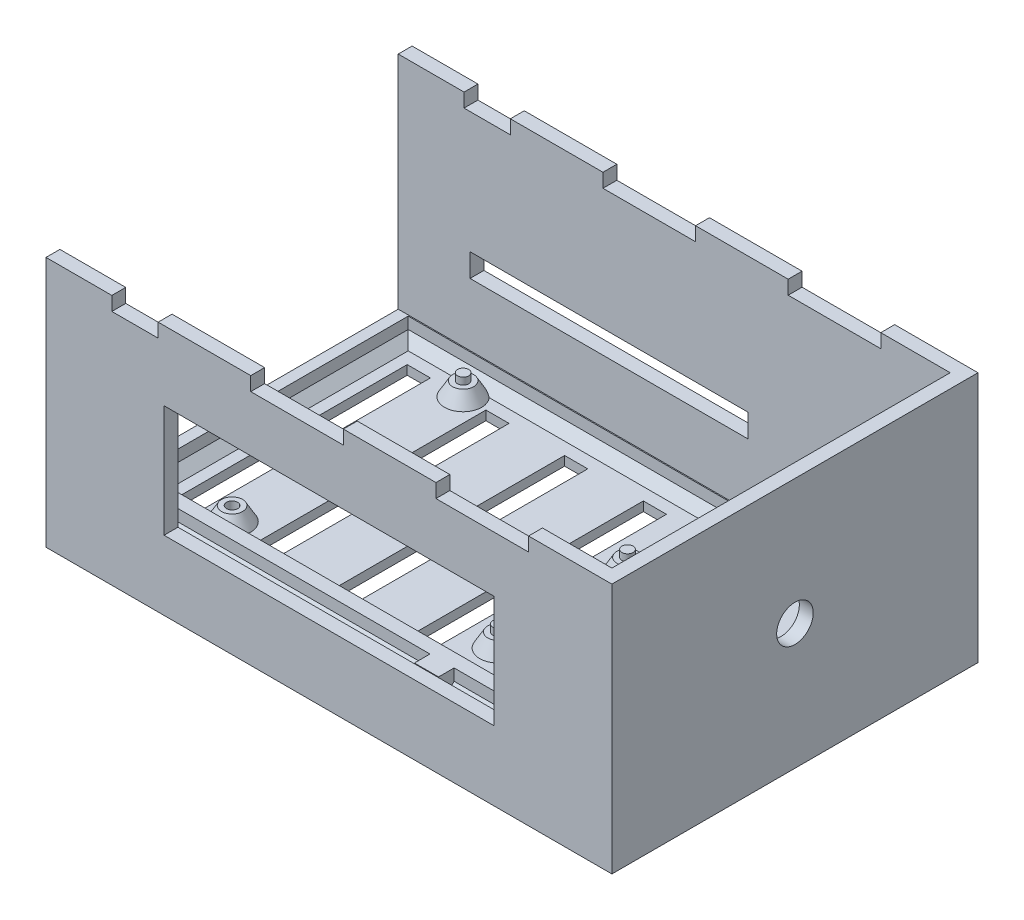
from build123d import *

# Parameters (mm, degrees)
SKETCH_1_W              = 95
SKETCH_1_H              = 100
EXTRUDE_1_DEPTH         = 2
SKETCH_3_R              = 1.2
EXTRUDE_2_DEPTH         = 7
SKETCH_4_R              = 2
EXTRUDE_3_DEPTH         = 3
CHAMFER_1_SIZE          = 2
CHAMFER_1_SIZE_2        = 3.464101615
SKETCH_5_W              = 88.6
SKETCH_5_H              = 22
SKETCH_5_H_2            = 10
EXTRUDE_4_DEPTH         = 50
SKETCH_8_W              = 2.378668295
SKETCH_8_H              = 57.848959614
SKETCH_8_W_2            = 2.852804632
EXTRUDE_6_DEPTH         = 4.5
SKETCH_7_W              = 5
SKETCH_7_H              = 50
SKETCH_7_H_2            = 9
SKETCH_7_H_3            = 5
CUT_EXTRUDE_1_DEPTH     = 4
CHAMFER_START           = -83.16108201
CHAMFER_2_DEPTH         = 12
CHAMFER_START_2         = -66.16108201
CHAMFER_2_2_DEPTH       = 12
CHAMFER_START_3         = -49.16108201
CHAMFER_2_3_DEPTH       = 12
CHAMFER_START_4         = -32.16108201
CHAMFER_2_4_DEPTH       = 12
CHAMFER_START_5         = -15.16108201
CHAMFER_2_5_DEPTH       = 12.308277378
CHAMFER_START_6         = -92.621331705
CHAMFER_2_6_DEPTH       = 4.460249695
CHAMFER_2_7_DEPTH       = 89.768527073
CHAMFER_START_7         = 1
CHAMFER_2_8_DEPTH       = 86.998233291
CHAMFER_2_9_DEPTH       = 26.149273677
CHAMFER_START_8         = 84.998233291
CHAMFER_2_10_DEPTH      = 14.001766709
SKETCH_13_W             = 5.505876785
SKETCH_13_H             = 3
CUT_EXTRUDE_6_DEPTH     = 10
SKETCH_17_W             = 2
SKETCH_17_H             = 2
SKETCH_17_W_2           = 0.768088879
EXTRUDE_9_DEPTH         = 20
CHAMFER_3_SIZE          = 2
CHAMFER_3_SIZE_2        = 3.464101615
CHAMFER_6_SIZE          = 4
SKETCH_18_W             = 4.206221656
SKETCH_18_H             = 3.021554381
SKETCH_18_W_2           = 5.210107228
SKETCH_18_H_2           = 3.356992826
EXTRUDE_11_DEPTH        = 50
FILLET_2_R              = 2
SKETCH_20_W             = 2.378668295
SKETCH_20_H             = 7.010495323
EXTRUDE_13_DEPTH        = 30
SKETCH_21_W             = 2.378668295
SKETCH_21_H             = 4.566526532
EXTRUDE_14_DEPTH        = 12
SKETCH_22_R             = 1.2
CUT_EXTRUDE_7_DEPTH     = 3
SKETCH_24_W             = 14.181336584
SKETCH_24_H             = 31.500920509
CUT_EXTRUDE_8_DEPTH     = 1
CHAMFER_7_SIZE          = 2
CORTAR_EXTRUIR1_DEPTH   = 147.714007511
CROQUIS4_W              = 122.22
CROQUIS4_H              = 54.22
CROQUIS4_W_2            = 71.22
CROQUIS4_H_2            = 24.22
SALIENTE_EXTRUIR2_DEPTH = 3
CROQUIS5_W              = 100
CROQUIS5_H              = 6.5
SALIENTE_EXTRUIR3_DEPTH = 27.22
CROQUIS10_W             = 122.22
CROQUIS10_H             = 23.928408898
CORTAR_EXTRUIR2_DEPTH   = 149.024316921
SALIENTE_EXTRUIR4_REACH = 170.148
CROQUIS13_W             = 1.988266343
CROQUIS13_H             = 6.5
CROQUIS14_W             = 122.22
CROQUIS14_H             = 54.22
SALIENTE_EXTRUIR5_DEPTH = 3
CROQUIS15_W             = 79.071591102
CROQUIS15_H             = 54.22
SALIENTE_EXTRUIR6_DEPTH = 3
CROQUIS16_R             = 3.95
CORTAR_EXTRUIR3_DEPTH   = 169.147723148
CROQUIS18_W             = 10
CROQUIS18_H             = 3
CROQUIS18_W_2           = 20
CORTAR_EXTRUIR4_DEPTH   = 3
CROQUIS23_W             = 60
CROQUIS23_H             = 5
CORTAR_EXTRUIR5_DEPTH   = 3


with BuildPart() as part:
    # Эскиз1 → Бобышка-Вытянуть1 (new body)
    with BuildSketch(Plane(origin=(0, 0, 0), x_dir=(1, 0, 0), z_dir=(0, 1, 0))):
        with Locations((-47.5, -50)):
            Rectangle(SKETCH_1_W, SKETCH_1_H)
    extrude(amount=-EXTRUDE_1_DEPTH)

    # Эскиз3 → Бобышка-Вытянуть2 (add)
    with BuildSketch(Plane(origin=(0, 0, 0), x_dir=(1, 0, 0), z_dir=(0, 1, 0))):
        with Locations(Location((-76.12379646, -31.787862309, 0), (0, 0, 90))):
            Circle(SKETCH_3_R)
        with Locations(Location((-25.32379646, -47.087862309, 0), (0, 0, 90))):
            Circle(SKETCH_3_R)
        with Locations(Location((-25.32379646, -74.987862309, 0), (0, 0, 90))):
            Circle(SKETCH_3_R)
    extrude(amount=EXTRUDE_2_DEPTH)

    # Эскиз4 → Бобышка-Вытянуть3 (add)
    with BuildSketch(Plane(origin=(0, 0, 0), x_dir=(1, 0, 0), z_dir=(0, 1, 0))):
        with Locations(Location((-76.12379646, -31.787862309, 0), (0, 0, 90))):
            Circle(SKETCH_4_R)
        with Locations(Location((-25.32379646, -47.087862309, 0), (0, 0, 90))):
            Circle(SKETCH_4_R)
        with Locations(Location((-25.32379646, -74.987862309, 0), (0, 0, 90))):
            Circle(SKETCH_4_R)
        with Locations(Location((-77.72379646, -80.087862309, 0), (0, 0, 90))):
            Circle(SKETCH_4_R)
    extrude(amount=EXTRUDE_3_DEPTH)

    # Фаска1
    # the kernel refuses this chamfer: 3.464101615, 2 mm, written as the material it adds along each edge
    with BuildSketch(Plane(origin=(-25.32379646, 0, 47.087862309), x_dir=(0, 0, -1), z_dir=(1, 0, 0))) as chamfer_1_piece_1_section:
        Polygon((2 + CHAMFER_1_SIZE, 0), (2, CHAMFER_1_SIZE_2), (2, 0), align=None)
    chamfer_1_piece_1 = revolve(axis=Axis((-25.32379646, 0, 47.087862309), (0, 1, 0)), mode=Mode.PRIVATE)
    chamfer_1_piece_1 = split(chamfer_1_piece_1, bisect_by=Plane(origin=(-25.32379646, 3, 47.087862309), z_dir=(0, -1, 0)), keep=Keep.TOP, mode=Mode.PRIVATE)
    add(chamfer_1_piece_1)
    with BuildSketch(Plane(origin=(-76.12379646, 0, 31.787862309), x_dir=(0, 0, -1), z_dir=(1, 0, 0))) as chamfer_1_piece_2_section:
        Polygon((2 + CHAMFER_1_SIZE, 0), (2, CHAMFER_1_SIZE_2), (2, 0), align=None)
    chamfer_1_piece_2 = revolve(axis=Axis((-76.12379646, 0, 31.787862309), (0, 1, 0)), mode=Mode.PRIVATE)
    chamfer_1_piece_2 = split(chamfer_1_piece_2, bisect_by=Plane(origin=(-76.12379646, 3, 31.787862309), z_dir=(0, -1, 0)), keep=Keep.TOP, mode=Mode.PRIVATE)
    add(chamfer_1_piece_2)
    with BuildSketch(Plane(origin=(-77.72379646, 0, 80.087862309), x_dir=(0, 0, -1), z_dir=(1, 0, 0))) as chamfer_1_piece_3_section:
        Polygon((2 + CHAMFER_1_SIZE, 0), (2, CHAMFER_1_SIZE_2), (2, 0), align=None)
    chamfer_1_piece_3 = revolve(axis=Axis((-77.72379646, 0, 80.087862309), (0, 1, 0)), mode=Mode.PRIVATE)
    chamfer_1_piece_3 = split(chamfer_1_piece_3, bisect_by=Plane(origin=(-77.72379646, 3, 80.087862309), z_dir=(0, -1, 0)), keep=Keep.TOP, mode=Mode.PRIVATE)
    add(chamfer_1_piece_3)
    with BuildSketch(Plane(origin=(-25.32379646, 0, 74.987862309), x_dir=(0, 0, -1), z_dir=(1, 0, 0))) as chamfer_1_piece_4_section:
        Polygon((2 + CHAMFER_1_SIZE, 0), (2, CHAMFER_1_SIZE_2), (2, 0), align=None)
    chamfer_1_piece_4 = revolve(axis=Axis((-25.32379646, 0, 74.987862309), (0, 1, 0)), mode=Mode.PRIVATE)
    chamfer_1_piece_4 = split(chamfer_1_piece_4, bisect_by=Plane(origin=(-25.32379646, 3, 74.987862309), z_dir=(0, -1, 0)), keep=Keep.TOP, mode=Mode.PRIVATE)
    add(chamfer_1_piece_4)

    # Эскиз5 → Бобышка-Вытянуть4 (add)
    # profile 1 of 2: a face of its own
    with BuildSketch(Plane(origin=(0, 0, 0), x_dir=(1, 0, 0), z_dir=(0, 1, 0))):
        Polygon((0, 0), (-95, 0), (-95, -3), (-95, -24.149273677), (-95, -27.149273677), (0, -27.149273677), (0, -24.149273677), (0, -3), align=None)
        with Locations((-47.5, -13.149273677)):
            Rectangle(SKETCH_5_W, SKETCH_5_H, mode=Mode.SUBTRACT)
    # profile 2 of 2: a face of its own
    with BuildSketch(Plane(origin=(0, 0, 0), x_dir=(1, 0, 0), z_dir=(0, 1, 0))):
        Polygon((0, -100), (-95, -100), (-95, -97), (-95, -87.998233291), (-95, -84.998233291), (0, -84.998233291), (0, -87.998233291), (0, -97), align=None)
        with Locations((-47.5, -92.998233291)):
            Rectangle(SKETCH_5_W, SKETCH_5_H_2, mode=Mode.SUBTRACT)
    extrude(amount=EXTRUDE_4_DEPTH)

    # Эскиз8 → Бобышка-Вытянуть6 (add)
    with BuildSketch(Plane(origin=(0, 0, 0), x_dir=(1, 0, 0), z_dir=(0, 1, 0))):
        with Locations((-93.810665852, -56.073753484)):
            Rectangle(SKETCH_8_W, SKETCH_8_H)
        with Locations((-1.426402316, -56.073753484)):
            Rectangle(SKETCH_8_W_2, SKETCH_8_H)
    extrude(amount=EXTRUDE_6_DEPTH)

    # Эскиз7 → Вырез-Вытянуть1 (cut)
    with BuildSketch(Plane(origin=(0, 0, 0), x_dir=(1, 0, 0), z_dir=(0, 1, 0))):
        with Locations((-68.66108201, -56.826653613)):
            Rectangle(SKETCH_7_W, SKETCH_7_H)
        with Locations((-85.66108201, -56.826653613)):
            Rectangle(SKETCH_7_W, SKETCH_7_H)
        with Locations((-68.66108201, -10.718973477)):
            Rectangle(SKETCH_7_W, SKETCH_7_H_2)
        with Locations((-85.66108201, -10.718973477)):
            Rectangle(SKETCH_7_W, SKETCH_7_H_2)
        with Locations((-85.66108201, -92.084172994)):
            Rectangle(SKETCH_7_W, SKETCH_7_H_3)
        with Locations((-51.66108201, -56.826653613)):
            Rectangle(SKETCH_7_W, SKETCH_7_H)
        with Locations((-34.66108201, -56.826653613)):
            Rectangle(SKETCH_7_W, SKETCH_7_H)
        with Locations((-17.66108201, -56.826653613)):
            Rectangle(SKETCH_7_W, SKETCH_7_H)
        with Locations((-68.66108201, -92.084172994)):
            Rectangle(SKETCH_7_W, SKETCH_7_H_3)
        with Locations((-51.66108201, -10.718973477)):
            Rectangle(SKETCH_7_W, SKETCH_7_H_2)
        with Locations((-51.66108201, -92.084172994)):
            Rectangle(SKETCH_7_W, SKETCH_7_H_3)
        with Locations((-34.66108201, -10.718973477)):
            Rectangle(SKETCH_7_W, SKETCH_7_H_2)
        with Locations((-34.66108201, -92.084172994)):
            Rectangle(SKETCH_7_W, SKETCH_7_H_3)
        with Locations((-17.66108201, -10.718973477)):
            Rectangle(SKETCH_7_W, SKETCH_7_H_2)
        with Locations((-17.66108201, -92.084172994)):
            Rectangle(SKETCH_7_W, SKETCH_7_H_3)
    extrude(amount=-CUT_EXTRUDE_1_DEPTH, mode=Mode.SUBTRACT)

    # Фаска2: read off the stored shape, not the designer's step
    # Фаска2 outline → Фаска2 (add)
    with BuildSketch(Plane.YZ.offset(CHAMFER_START)):
        Polygon((0, 89.998233291), (0, 89.584172994), (0.414060297, 89.584172994), align=None)
    extrude(amount=CHAMFER_2_DEPTH)

    # Chamfer 2 2 outline → Chamfer 2 2 (add)
    with BuildSketch(Plane.YZ.offset(CHAMFER_START_2)):
        Polygon((0, 89.998233291), (0, 89.584172994), (0.414060297, 89.584172994), align=None)
    extrude(amount=CHAMFER_2_2_DEPTH)

    # Chamfer 2 3 outline → Chamfer 2 3 (add)
    with BuildSketch(Plane.YZ.offset(CHAMFER_START_3)):
        Polygon((0, 89.998233291), (0, 89.584172994), (0.414060297, 89.584172994), align=None)
    extrude(amount=CHAMFER_2_3_DEPTH)

    # Chamfer 2 4 outline → Chamfer 2 4 (add)
    with BuildSketch(Plane.YZ.offset(CHAMFER_START_4)):
        Polygon((0, 89.998233291), (0, 89.584172994), (0.414060297, 89.584172994), align=None)
    extrude(amount=CHAMFER_2_4_DEPTH)

    # Chamfer 2 5 outline → Chamfer 2 5 (add)
    with BuildSketch(Plane.YZ.offset(CHAMFER_START_5)):
        Polygon((0, 89.998233291), (0, 89.584172994), (0.414060297, 89.584172994), align=None)
    extrude(amount=CHAMFER_2_5_DEPTH)

    # Chamfer 2 6 outline → Chamfer 2 6 (add)
    with BuildSketch(Plane.YZ.offset(CHAMFER_START_6)):
        Polygon((0, 89.998233291), (0, 89.584172994), (0.414060297, 89.584172994), align=None)
    extrude(amount=CHAMFER_2_6_DEPTH)

    # Chamfer 2 7 outline → Chamfer 2 7 (add)
    with BuildSketch(Plane.YZ.offset(CHAMFER_START_6)):
        Polygon((0, 97.998233291), (0, 95.998233291), (2, 97.998233291), align=None)
        Polygon((0.414060297, 89.584172994), (0, 89.584172994), (0, 87.998233291), (2, 87.998233291), align=None)
        Polygon((0, 24.149273677), (0, 22.149273677), (2, 24.149273677), align=None)
        Polygon((2, 2.149273677), (0, 4.149273677), (0, 2.149273677), align=None)
        Polygon((0, 27.149273677), (2, 27.149273677), (0, 29.149273677), align=None)
        Polygon((0, 84.998233291), (0, 82.998233291), (2, 84.998233291), align=None)
    extrude(amount=CHAMFER_2_7_DEPTH)

    # Chamfer 2 8 outline → Chamfer 2 8 (add)
    with BuildSketch(Plane.XY.offset(CHAMFER_START_7)):
        Polygon((-92.621331705, 0), (-90.621331705, 0), (-92.621331705, 2), align=None)
        Polygon((-4.852804632, 0), (-2.852804632, 0), (-2.852804632, 2), align=None)
    extrude(amount=CHAMFER_2_8_DEPTH)

    # Chamfer 2 9 outline → Chamfer 2 9 (add)
    with BuildSketch(Plane.XY.offset(CHAMFER_START_7)):
        Polygon((-3.2, 2), (-5.2, 0), (-4.852804632, 0), (-3.2, 1.652804632), align=None)
        Polygon((-89.8, 0), (-91.8, 2), (-91.8, 1.178668295), (-90.621331705, 0), align=None)
    extrude(amount=CHAMFER_2_9_DEPTH)

    # Chamfer 2 10 outline → Chamfer 2 10 (add)
    with BuildSketch(Plane.XY.offset(CHAMFER_START_8)):
        Polygon((-89.8, 0), (-91.8, 2), (-91.8, 0), align=None)
    extrude(amount=CHAMFER_2_10_DEPTH)

    # Эскиз13 → Вырез-Вытянуть6 (cut)
    with BuildSketch(Plane(origin=(0, 50, 0), x_dir=(1, 0, 0), z_dir=(0, 1, 0))):
        with Locations((-13.994725416, -25.649273677)):
            Rectangle(SKETCH_13_W, SKETCH_13_H)
        with Locations((-13.994725416, -86.498233291)):
            Rectangle(SKETCH_13_W, SKETCH_13_H)
    extrude(amount=-CUT_EXTRUDE_6_DEPTH, mode=Mode.SUBTRACT)

    # Эскиз17 → Бобышка-Вытянуть9 (add)
    with BuildSketch(Plane(origin=(0, 50, 0), x_dir=(1, 0, 0), z_dir=(0, 1, 0))):
        with Locations((-91.621331705, -28.149273677)):
            Rectangle(SKETCH_17_W, SKETCH_17_H)
        with Locations((-91.621331705, -83.998233291)):
            Rectangle(SKETCH_17_W, SKETCH_17_H)
        with Locations((-5.236849072, -83.998233291)):
            Rectangle(SKETCH_17_W_2, SKETCH_17_H)
        with Locations((-3.852804632, -28.149273677)):
            Rectangle(SKETCH_17_W, SKETCH_17_H)
    extrude(amount=-EXTRUDE_9_DEPTH)

    # Фаска3
    # the kernel refuses this chamfer: 3.464101615, 2 mm, written as the material it adds along each edge
    with BuildSketch(Plane(origin=(-5.620893511, 30, 84.998233291), x_dir=(0, -1, 0), z_dir=(1, 0, 0))) as chamfer_3_piece_1_section:
        Polygon((CHAMFER_3_SIZE, 0), (0, CHAMFER_3_SIZE_2), (0, 0), align=None)
    chamfer_3_piece_1 = extrude(amount=0.768088879, mode=Mode.PRIVATE)
    chamfer_3_piece_1 = split(chamfer_3_piece_1, bisect_by=Plane(origin=(-5.620893511, 30, 82.998233291), z_dir=(0, 0, 1)), keep=Keep.TOP, mode=Mode.PRIVATE)
    add(chamfer_3_piece_1)
    with BuildSketch(Plane(origin=(-92.621331705, 30, 84.998233291), x_dir=(0, -1, 0), z_dir=(1, 0, 0))) as chamfer_3_piece_2_section:
        Polygon((CHAMFER_3_SIZE_2, 0), (0, CHAMFER_3_SIZE), (0, 0), align=None)
    chamfer_3_piece_2 = extrude(amount=2, mode=Mode.PRIVATE)
    chamfer_3_piece_2 = split(chamfer_3_piece_2, bisect_by=Plane(origin=(-92.621331705, 30, 82.998233291), z_dir=(0, 0, 1)), keep=Keep.TOP, mode=Mode.PRIVATE)
    add(chamfer_3_piece_2)
    with BuildSketch(Plane(origin=(-92.621331705, 30, 27.149273677), x_dir=(0, -1, 0), z_dir=(1, 0, 0))) as chamfer_3_piece_3_section:
        Polygon((CHAMFER_3_SIZE_2, 0), (0, -CHAMFER_3_SIZE), (0, 0), align=None)
    chamfer_3_piece_3 = extrude(amount=2, mode=Mode.PRIVATE)
    chamfer_3_piece_3 = split(chamfer_3_piece_3, bisect_by=Plane(origin=(-92.621331705, 30, 29.149273677), z_dir=(0, 0, -1)), keep=Keep.TOP, mode=Mode.PRIVATE)
    add(chamfer_3_piece_3)
    with BuildSketch(Plane(origin=(-2.852804632, 30, 27.149273677), x_dir=(0, -1, 0), z_dir=(-1, 0, 0))) as chamfer_3_piece_4_section:
        Polygon((CHAMFER_3_SIZE_2, 0), (0, CHAMFER_3_SIZE), (0, 0), align=None)
    chamfer_3_piece_4 = extrude(amount=2, mode=Mode.PRIVATE)
    chamfer_3_piece_4 = split(chamfer_3_piece_4, bisect_by=Plane(origin=(-2.852804632, 30, 29.149273677), z_dir=(0, 0, -1)), keep=Keep.TOP, mode=Mode.PRIVATE)
    add(chamfer_3_piece_4)

    # Фаска6
    chamfer_6_edges = [part.edges().sort_by_distance(p)[0] for p in [
        (-91.8, 26, 24.149273677),
        (-91.8, 26, 2.149273677),
        (-91.8, 26, 87.998233291),
        (-3.2, 26, 24.149273677),
        (-3.2, 26, 97.998233291),
        (-3.2, 26, 2.149273677),
    ]]
    chamfer(chamfer_6_edges, length=CHAMFER_6_SIZE - 0.0001)  # a hair under: the kernel refuses the full size

    # Эскиз18 → Бобышка-Вытянуть11 (add)
    with BuildSketch(Plane(origin=(0, 0, 0), x_dir=(1, 0, 0), z_dir=(0, 1, 0))):
        with Locations((-19.755724458, -22.638496487)):
            Rectangle(SKETCH_18_W, SKETCH_18_H)
        with Locations((-24.4638889, -89.676729704)):
            Rectangle(SKETCH_18_W_2, SKETCH_18_H_2)
    extrude(amount=EXTRUDE_11_DEPTH)

    # Скругление2
    fillet_2_edges = [part.edges().sort_by_distance(p)[0] for p in [
        (-16.747663808, 40, 25.649273677),
        (-11.241787023, 40, 25.649273677),
        (-11.241787023, 40, 86.498233291),
        (-16.747663808, 40, 86.498233291),
    ]]
    fillet(fillet_2_edges, radius=FILLET_2_R)

    # Эскиз20 → Бобышка-Вытянуть13 (add)
    with BuildSketch(Plane(origin=(0, 4.5, 0), x_dir=(1, 0, 0), z_dir=(0, 1, 0))):
        with Locations((-93.810665852, -30.654521339)):
            Rectangle(SKETCH_20_W, SKETCH_20_H)
    extrude(amount=EXTRUDE_13_DEPTH)

    # Эскиз21 → Бобышка-Вытянуть14 (add)
    with BuildSketch(Plane(origin=(0, 4.5, 0), x_dir=(1, 0, 0), z_dir=(0, 1, 0))):
        with Locations((-93.810665852, -82.714970025)):
            Rectangle(SKETCH_21_W, SKETCH_21_H)
    extrude(amount=EXTRUDE_14_DEPTH)

    # Эскиз22 → Вырез-Вытянуть7 (cut)
    with BuildSketch(Plane(origin=(0, 3, 0), x_dir=(1, 0, 0), z_dir=(0, 1, 0))):
        with Locations(Location((-77.72379646, -80.087862309, 0), (0, 0, 270))):
            Circle(SKETCH_22_R)
    extrude(amount=-CUT_EXTRUDE_7_DEPTH, mode=Mode.SUBTRACT)

    # Эскиз24 → Вырез-Вытянуть8 (cut)
    with BuildSketch(Plane.XY.offset(87.998233291)):
        with Locations((-53.545237887, 34.249539746)):
            Rectangle(SKETCH_24_W, SKETCH_24_H)
    extrude(amount=-CUT_EXTRUDE_8_DEPTH, mode=Mode.SUBTRACT)

    # Фаска7
    chamfer_7_edges = [part.edges().sort_by_distance(p)[0] for p in [
        (-91.8, 26, 97.998233291),
    ]]
    chamfer(chamfer_7_edges, length=CHAMFER_7_SIZE)

    # Croquis1 → Cortar-Extruir1 (cut, through all)
    with BuildSketch(Plane(origin=(0, 0, 0), x_dir=(0, 0, -1), z_dir=(1, 0, 0))):
        Polygon((-84.998233291, 4.5), (-100, 4.5), (-100, 50), (0, 50), (0, 4.5), align=None)
    extrude(amount=-CORTAR_EXTRUIR1_DEPTH, mode=Mode.SUBTRACT)

    # Croquis4 → Saliente-Extruir2 (add)
    with BuildSketch(Plane.XY.offset(100)):
        with Locations((-33.89, 25.11)):
            Rectangle(CROQUIS4_W, CROQUIS4_H)
        with Locations((-33.89, 25.11)):
            Rectangle(CROQUIS4_W_2, CROQUIS4_H_2, mode=Mode.SUBTRACT)
    extrude(amount=SALIENTE_EXTRUIR2_DEPTH)

    # Croquis5 → Saliente-Extruir3 (add)
    with BuildSketch(Plane(origin=(0, 0, 0), x_dir=(0, 0, -1), z_dir=(1, 0, 0))):
        with Locations((-50, 1.25)):
            Rectangle(CROQUIS5_W, CROQUIS5_H)
    extrude(amount=SALIENTE_EXTRUIR3_DEPTH)

    # Croquis10 → Cortar-Extruir2 (cut, through all)
    with BuildSketch(Plane(origin=(0, 4.5, 0), x_dir=(1, 0, 0), z_dir=(0, 1, 0))):
        with Locations((-33.89, -11.964204449)):
            Rectangle(CROQUIS10_W, CROQUIS10_H)
    extrude(amount=-CORTAR_EXTRUIR2_DEPTH, mode=Mode.SUBTRACT)

    # Croquis13 → Saliente-Extruir4 (add, up to next)
    with BuildSketch(Plane.ZY.offset(95), mode=Mode.PRIVATE) as saliente_extruir4_sk1:
        with Locations((24.92254207, 1.25)):
            Rectangle(CROQUIS13_W, CROQUIS13_H)
    saliente_extruir4_tool1 = extrude(saliente_extruir4_sk1.sketch, amount=-SALIENTE_EXTRUIR4_REACH, mode=Mode.PRIVATE) - part.part
    add(saliente_extruir4_tool1.solids().sort_by_distance((-95, 1.25, 24.922542))[0])
    add(saliente_extruir4_tool1.solids().sort_by_distance((-95, 1.25, 24.922542))[1])

    # Croquis14 → Saliente-Extruir5 (add)
    with BuildSketch(Plane(origin=(0, 0, 23.928408898), x_dir=(-1, 0, 0), z_dir=(0, 0, -1))):
        with Locations((33.89, 25.11)):
            Rectangle(CROQUIS14_W, CROQUIS14_H)
    extrude(amount=-SALIENTE_EXTRUIR5_DEPTH)

    # Croquis15 → Saliente-Extruir6 (add)
    with BuildSketch(Plane(origin=(27.22, 0, 0), x_dir=(0, 0, -1), z_dir=(1, 0, 0))):
        with Locations((-63.464204449, 25.11)):
            Rectangle(CROQUIS15_W, CROQUIS15_H)
    extrude(amount=-SALIENTE_EXTRUIR6_DEPTH)

    # Croquis16 → Cortar-Extruir3 (cut, through all)
    with BuildSketch(Plane(origin=(27.22, 0, 0), x_dir=(0, 0, -1), z_dir=(1, 0, 0))):
        with Locations((-63.464204449, 25.11)):
            Circle(CROQUIS16_R)
    extrude(amount=-CORTAR_EXTRUIR3_DEPTH, mode=Mode.SUBTRACT)

    # Croquis18 → Cortar-Extruir4 (cut)
    with BuildSketch(Plane(origin=(0, 52.22, 0), x_dir=(1, 0, 0), z_dir=(0, 1, 0))):
        with Locations((-75.78, -25.428408898)):
            Rectangle(CROQUIS18_W, CROQUIS18_H)
        with Locations((-0.78, -25.428408898)):
            Rectangle(CROQUIS18_W_2, CROQUIS18_H)
        with Locations((-40.78, -25.428408898)):
            Rectangle(CROQUIS18_W_2, CROQUIS18_H)
    cortar_extruir4 = extrude(amount=-CORTAR_EXTRUIR4_DEPTH, mode=Mode.SUBTRACT)

    # Simetría3: Cortar-Extruir4 across plane
    add(cortar_extruir4.mirror(Plane.XY.offset(63.464204449)), mode=Mode.SUBTRACT)

    # Croquis23 → Cortar-Extruir5 (cut)
    with BuildSketch(Plane(origin=(0, 0, 23.928408898), x_dir=(-1, 0, 0), z_dir=(0, 0, -1))):
        with Locations((49.487159882, 20.5)):
            Rectangle(CROQUIS23_W, CROQUIS23_H)
    extrude(amount=-CORTAR_EXTRUIR5_DEPTH, mode=Mode.SUBTRACT)


solid = part.part
